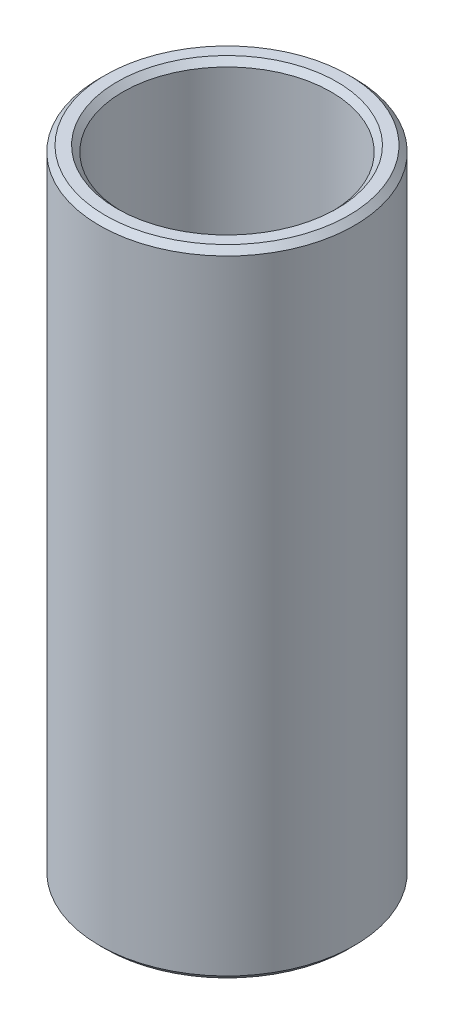
from build123d import *

# Parameters (mm, degrees)
SKETCH1_R           = 30
BOSS_EXTRUDE1_DEPTH = 149.494594201
SKETCH2_R           = 24.507054004
CUT_EXTRUDE1_DEPTH  = 156.398306604
CHAMFER1_SIZE       = 1.368878214


with BuildPart() as part:
    # Sketch1 → Boss-Extrude1 (new body)
    with BuildSketch(Plane(origin=(0, 0, 0), x_dir=(1, 0, 0), z_dir=(0, 1, 0))):
        Circle(SKETCH1_R)
    extrude(amount=BOSS_EXTRUDE1_DEPTH)

    # Sketch2 → Cut-Extrude1 (cut, through all)
    with BuildSketch(Plane(origin=(0, 0, 0), x_dir=(1, 0, 0), z_dir=(0, 1, 0))):
        Circle(SKETCH2_R)
    extrude(amount=CUT_EXTRUDE1_DEPTH, mode=Mode.SUBTRACT)

    # Chamfer1
    chamfer1_edges = [part.edges().sort_by_distance(p)[0] for p in [
        (-24.507054004, 149.494594201, 0),
        (-24.507054004, 0, 0),
        (-30, 0, 0),
        (-30, 149.494594201, 0),
    ]]
    chamfer(chamfer1_edges, length=CHAMFER1_SIZE)


solid = part.part
